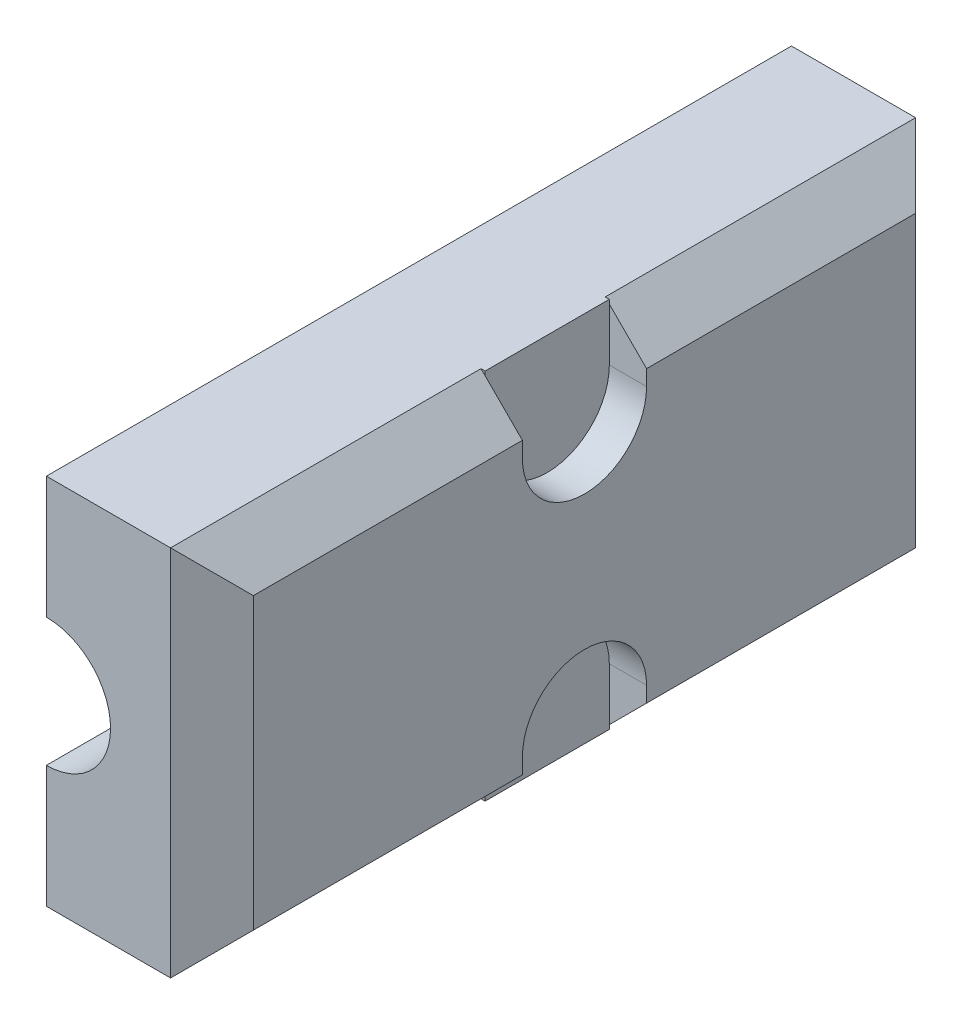
from build123d import *

# Parameters (mm, degrees)
SKETCH_1_W          = 36
SKETCH_1_H          = 18
EXTRUDE_1_DEPTH     = 8
CUT_EXTRUDE_1_DEPTH = 38.960505792
CHAMFER_1_SIZE      = 2
SKETCH_3_R          = 2
CUT_EXTRUDE_2_DEPTH = 22.656407828
CUT_EXTRUDE_3_DEPTH = 2
EXTRUDE_START       = 0.2
EXTRUDE_2_DEPTH     = 0.2


with BuildPart() as part:
    # Эскиз1 → Бобышка-Вытянуть1 (new body)
    with BuildSketch(Plane(origin=(0, 0, 0), x_dir=(0, 0, -1), z_dir=(1, 0, 0))):
        Rectangle(SKETCH_1_W, SKETCH_1_H)
    extrude(amount=EXTRUDE_1_DEPTH)

    # Эскиз2 → Вырез-Вытянуть1 (cut, through all)
    with BuildSketch(Plane.XY.offset(18)):
        with BuildLine():
            ThreePointArc((0, -3.1), (3.1, 0), (0, 3.1))
            Line((0, 3.1), (0, -3.1))
        make_face()
    extrude(amount=-CUT_EXTRUDE_1_DEPTH, mode=Mode.SUBTRACT)

    # Фаска1
    chamfer_1_edges = [part.edges().sort_by_distance(p)[0] for p in [
        (8, 0, 18),
        (8, -9, 0),
        (8, 0, -18),
        (8, 9, 0),
    ]]
    chamfer(chamfer_1_edges, length=CHAMFER_1_SIZE)

    # Эскиз3 → Вырез-Вытянуть2 (cut, through all)
    with BuildSketch(Plane(origin=(8, 0, 0), x_dir=(0, 0, -1), z_dir=(1, 0, 0))):
        with Locations((0, -6.25)):
            Circle(SKETCH_3_R)
        with Locations((0, 6.25)):
            Circle(SKETCH_3_R)
    extrude(amount=-CUT_EXTRUDE_2_DEPTH, mode=Mode.SUBTRACT)

    # Эскиз4 → Вырез-Вытянуть3 (cut)
    with BuildSketch(Plane(origin=(8, 0, 0), x_dir=(0, 0, -1), z_dir=(1, 0, 0))):
        with BuildLine():
            Line((-3, 9), (-3, 6.25))
            ThreePointArc((-3, 6.25), (0, 3.25), (3, 6.25))
            Line((3, 6.25), (3, 9))
            Line((3, 9), (-3, 9))
        make_face()
        with BuildLine():
            Line((3, -9), (3, -6.25))
            ThreePointArc((3, -6.25), (0, -3.25), (-3, -6.25))
            Line((-3, -6.25), (-3, -9))
            Line((-3, -9), (3, -9))
        make_face()
    extrude(amount=-CUT_EXTRUDE_3_DEPTH, mode=Mode.SUBTRACT)

    # Эскиз5 → Бобышка-Вытянуть2 (add)
    with BuildSketch(Plane(origin=(6, 0, 0), x_dir=(0, 0, -1), z_dir=(1, 0, 0)).offset(EXTRUDE_START)):
        with BuildLine():
            Line((3, 9), (-3, 9))
            Line((-3, 9), (-3, 6.25))
            ThreePointArc((-3, 6.25), (0, 3.25), (3, 6.25))
            Line((3, 6.25), (3, 9))
        make_face()
        with BuildLine():
            Line((-3, -9), (3, -9))
            Line((3, -9), (3, -6.25))
            ThreePointArc((3, -6.25), (0, -3.25), (-3, -6.25))
            Line((-3, -6.25), (-3, -9))
        make_face()
    extrude(amount=-EXTRUDE_2_DEPTH)


solid = part.part
